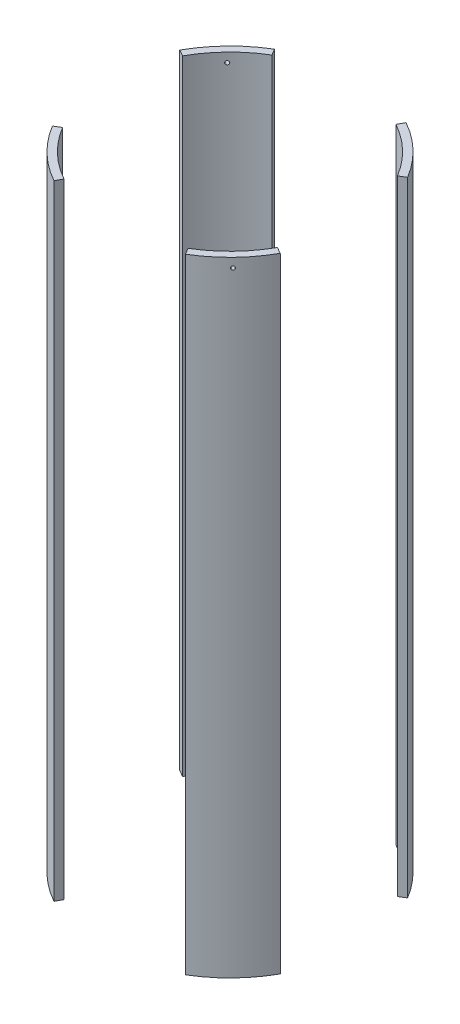
from build123d import *

# Parameters (mm, degrees)
SKETCH2_R               = 88.9
SKETCH2_R_2             = 83.82
BOSS_EXTRUDE1_DEPTH     = 214.3125
CUT_EXTRUDE1_DEPTH      = 249.467840286
CUT_EXTRUDE1_DEPTH_BACK = 249.467840286
SKETCH5_R               = 1.27
TOP_BOLT_HOLES_DEPTH    = 287.971679771
SKETCH6_R               = 1.27
BOTTOM_BOLT_HOLES_DEPTH = 31.75
BOLT_PATTERN_COUNT      = 4


with BuildPart() as part:
    # Sketch2 → Boss-Extrude1 (new, symmetric)
    with BuildSketch(Plane(origin=(0, 0, 0), x_dir=(1, 0, 0), z_dir=(0, 1, 0))):
        Circle(SKETCH2_R)
        Circle(SKETCH2_R_2, mode=Mode.SUBTRACT)
    extrude(amount=BOSS_EXTRUDE1_DEPTH, both=True)

    # Sketch3 → Cut-Extrude1 (cut, two sides: drawn at the far end of the back side and taken through both)
    with BuildSketch(Plane(origin=(0, 0, 0), x_dir=(1, 0, 0), z_dir=(0, 1, 0)).offset(-CUT_EXTRUDE1_DEPTH_BACK)):
        Polygon((-58.116685864, 96.974944394), (0, 0), (53.900027233, 96.974944394), align=None)
        Polygon((70.991745134, -118.45858783), (0, 0), (-65.840936026, -118.45858783), align=None)
        Polygon((169.661755759, 101.677593364), (0, 0), (169.661755759, -94.300371224), align=None)
        Polygon((-123.741299607, -74.157652604), (0, 0), (-123.741299607, 68.777140945), align=None)
    extrude(amount=CUT_EXTRUDE1_DEPTH + CUT_EXTRUDE1_DEPTH_BACK, mode=Mode.SUBTRACT)


with BuildPart() as cut_extrude1_piece_1:
    # of the separate pieces the step leaves, piece 1, a body of its own (cut_extrude1_pieces)
    add(part.part.solids().sort_by_distance((-45.699187432, -214.3125, -76.254798328))[0])


with BuildPart() as cut_extrude1_piece_2:
    # of the separate pieces the step leaves, piece 2, a body of its own (cut_extrude1_pieces)
    add(part.part.solids().sort_by_distance((45.699187432, -214.3125, 76.254798328))[0])


with BuildPart() as cut_extrude1_piece_3:
    # of the separate pieces the step leaves, piece 3, a body of its own (cut_extrude1_pieces)
    add(part.part.solids().sort_by_distance((76.254798328, -214.3125, -45.699187432))[0])


with BuildPart() as cut_extrude1_piece_4:
    # of the separate pieces the step leaves, piece 4, a body of its own (cut_extrude1_pieces)
    add(part.part.solids().sort_by_distance((-76.254798328, -214.3125, 45.699187432))[0])

    # Sketch5 → Top bolt holes (cut, through all)
    with BuildSketch(Plane(origin=(-56.309218645, 0, 58.175814955), x_dir=(-0.7185401515036821, 0, -0.6954854784084752), z_dir=(0.6954854784084752, 0, -0.7185401515036821))):
        with Locations((-0.02278764, 207.9625)):
            Circle(SKETCH5_R)
    top_bolt_holes = extrude(amount=-TOP_BOLT_HOLES_DEPTH, mode=Mode.SUBTRACT)

    # Sketch6 → Bottom bolt holes (cut)
    with BuildSketch(Plane(origin=(0, -214.3125, 0), x_dir=(-1, 0, 0), z_dir=(0, -1, 0))):
        with Locations((60.062125915, -62.053127484)):
            Circle(SKETCH6_R)
    bottom_bolt_holes = extrude(amount=-BOTTOM_BOLT_HOLES_DEPTH, mode=Mode.SUBTRACT)


with BuildPart() as bolt_pattern_tool:
    # Bolt pattern: Top bolt holes, Bottom bolt holes ×4 about axis
    bolt_pattern_axis = Axis((0, 214.3125, 0), (0, 1, 0))
    add([top_bolt_holes.rotate(bolt_pattern_axis, i * 360 / BOLT_PATTERN_COUNT) for i in range(1, BOLT_PATTERN_COUNT)])
    add([bottom_bolt_holes.rotate(bolt_pattern_axis, i * 360 / BOLT_PATTERN_COUNT) for i in range(1, BOLT_PATTERN_COUNT)])


with BuildPart() as cut_extrude1_piece_1_1:
    add(cut_extrude1_piece_1.part)

    # Bolt pattern: cut by bolt_pattern_tool
    add(bolt_pattern_tool.part, mode=Mode.SUBTRACT)


with BuildPart() as cut_extrude1_piece_2_1:
    add(cut_extrude1_piece_2.part)

    # Bolt pattern: cut by bolt_pattern_tool
    add(bolt_pattern_tool.part, mode=Mode.SUBTRACT)


with BuildPart() as cut_extrude1_piece_3_1:
    add(cut_extrude1_piece_3.part)

    # Bolt pattern: cut by bolt_pattern_tool
    add(bolt_pattern_tool.part, mode=Mode.SUBTRACT)


solid = Compound([cut_extrude1_piece_4.part, cut_extrude1_piece_1_1.part, cut_extrude1_piece_2_1.part, cut_extrude1_piece_3_1.part])
